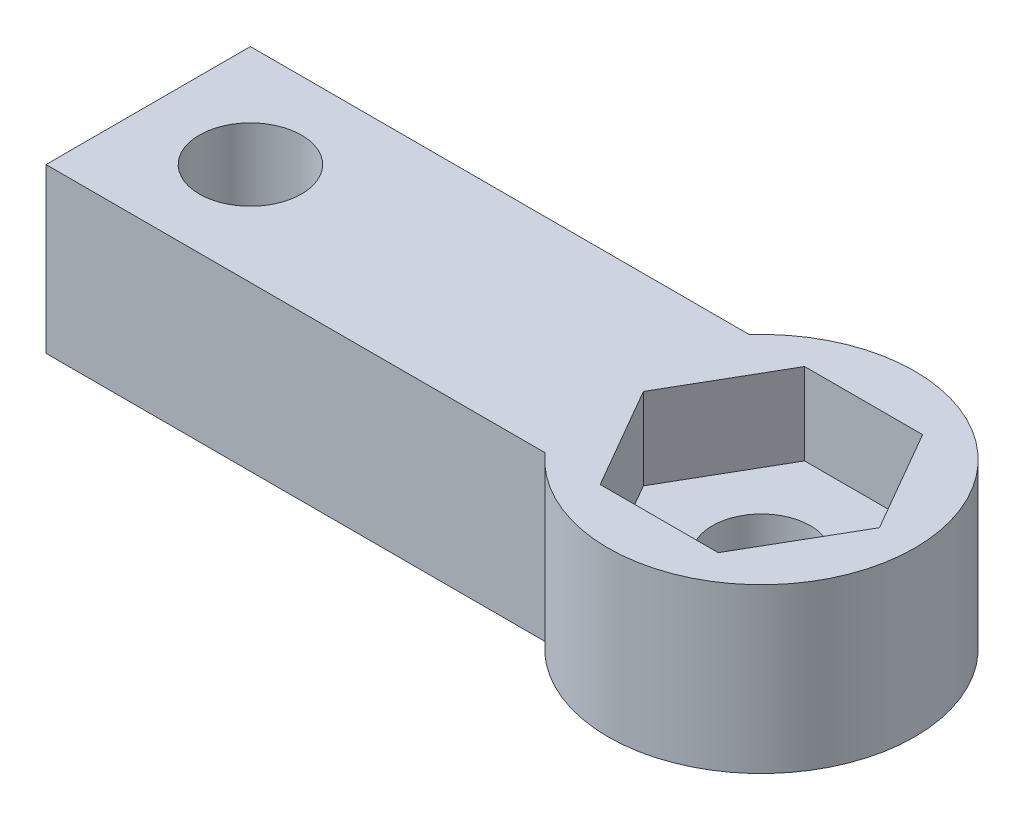
from build123d import *

# Parameters (mm, degrees)
SKETCH1_R           = 1.5875
BOSS_EXTRUDE1_DEPTH = 5.08
CUT_EXTRUDE1_DEPTH  = 2.54
SKETCH3_R           = 1.524
CUT_EXTRUDE2_DEPTH  = 2.54


with BuildPart() as part:
    # Sketch1 → Boss-Extrude1 (new body)
    with BuildSketch(Plane(origin=(0, 0, 0), x_dir=(1, 0, 0), z_dir=(0, 1, 0))):
        with BuildLine():
            Line((-3.549757914, 3.175), (-19.05, 3.175))
            Line((-19.05, 3.175), (-19.05, -3.175))
            Line((-19.05, -3.175), (-3.549757914, -3.175))
            ThreePointArc((-3.549757914, -3.175), (4.7625, 0), (-3.549757914, 3.175))
        make_face()
        with Locations((-15.875, 0)):
            Circle(SKETCH1_R, mode=Mode.SUBTRACT)
    extrude(amount=BOSS_EXTRUDE1_DEPTH)

    # Sketch2 → Cut-Extrude1 (cut)
    with BuildSketch(Plane(origin=(0, 5.08, 0), x_dir=(1, 0, 0), z_dir=(0, 1, 0))):
        Polygon((3.666174209, 0), (1.833087105, 3.175), (-1.833087105, 3.175), (-3.666174209, 0), (-1.833087105, -3.175), (1.833087105, -3.175), align=None)
    extrude(amount=-CUT_EXTRUDE1_DEPTH, mode=Mode.SUBTRACT)

    # Sketch3 → Cut-Extrude2 (cut)
    with BuildSketch(Plane.XZ):
        Circle(SKETCH3_R)
    extrude(amount=-CUT_EXTRUDE2_DEPTH, mode=Mode.SUBTRACT)


solid = part.part
